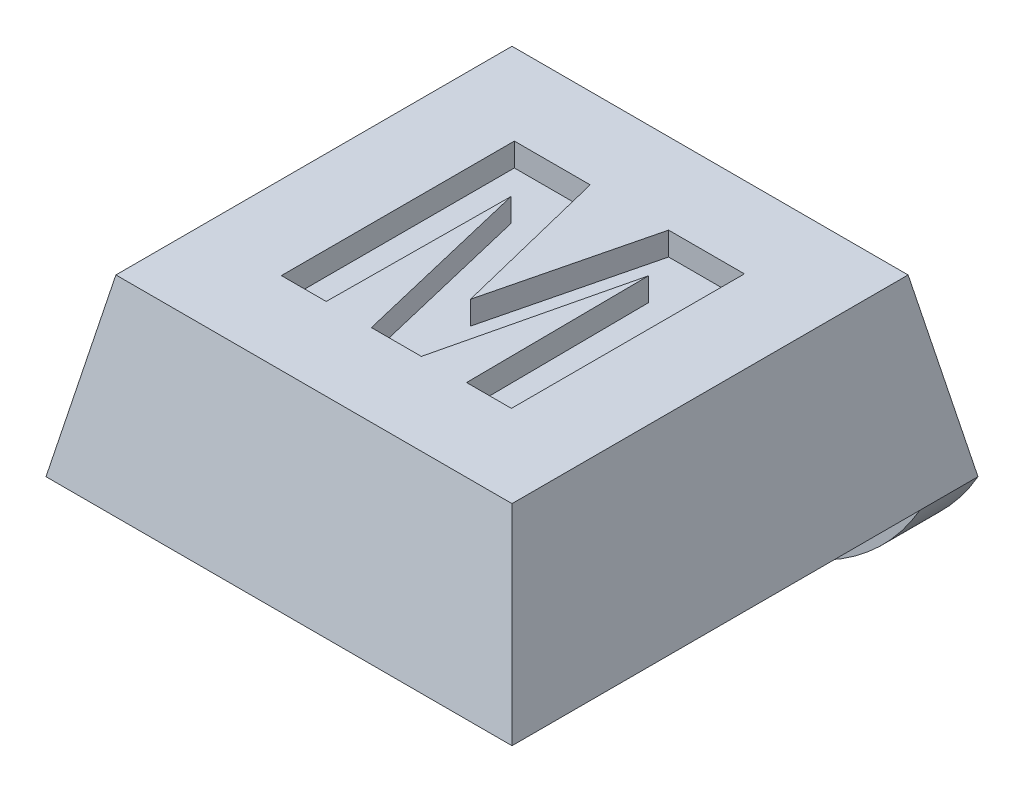
from build123d import *

# Parameters (mm, degrees)
SKETCH1_W               = 8
SKETCH1_H               = 8
BOSS_EXTRUDE1_DEPTH     = 3
CUT_EXTRUDE1_DEPTH      = 12.704699911
CUT_EXTRUDE1_DEPTH_BACK = 12.704699911
CUT_EXTRUDE2_DEPTH      = 11
SKETCH4_R               = 1.8
CUT_EXTRUDE3_DEPTH      = 0.8
SKETCH5_W               = 8
SKETCH5_H               = 1
BOSS_EXTRUDE2_DEPTH     = 2
FILLET1_R               = 4
CUT_EXTRUDE4_DEPTH      = 0.4


with BuildPart() as part:
    # Sketch1 → Boss-Extrude1 (new body)
    with BuildSketch(Plane(origin=(0, 0, 0), x_dir=(1, 0, 0), z_dir=(0, 1, 0))):
        with Locations((4, 4)):
            Rectangle(SKETCH1_W, SKETCH1_H)
    extrude(amount=BOSS_EXTRUDE1_DEPTH)

    # Sketch2 → Cut-Extrude1 (cut, two sides: drawn at the far end of the back side and taken through both)
    with BuildSketch(Plane.XY.offset(-CUT_EXTRUDE1_DEPTH_BACK)):
        Polygon((0, 0), (0.6, 3), (0, 3), align=None)
        Polygon((8, 0), (7.4, 3), (8, 3), align=None)
    extrude(amount=CUT_EXTRUDE1_DEPTH + CUT_EXTRUDE1_DEPTH_BACK, mode=Mode.SUBTRACT)

    # Sketch3 → Cut-Extrude2 (cut)
    with BuildSketch(Plane(origin=(0, 0, 0), x_dir=(0, 0, -1), z_dir=(1, 0, 0))):
        Polygon((0, 0), (0.6, 3), (0, 3), align=None)
        Polygon((8, 3), (7.4, 3), (8, 0), align=None)
    extrude(amount=CUT_EXTRUDE2_DEPTH, mode=Mode.SUBTRACT)

    # Sketch4 → Cut-Extrude3 (cut)
    with BuildSketch(Plane.XZ):
        with Locations(Location((4, -3.75, 0), (0, 0, 270))):
            Circle(SKETCH4_R)
    extrude(amount=-CUT_EXTRUDE3_DEPTH, mode=Mode.SUBTRACT)

    # Sketch5 → Boss-Extrude2 (add)
    with BuildSketch(Plane.XZ):
        with Locations((4, -7.5)):
            Rectangle(SKETCH5_W, SKETCH5_H)
    extrude(amount=BOSS_EXTRUDE2_DEPTH)

    # Fillet1
    # the kernel refuses this fillet: 4 mm, written as the material it takes off along each edge
    with BuildSketch(Plane(origin=(8, -2, -16.660254038), x_dir=(0, 1, 0), z_dir=(0, 0, 1)), Plane(origin=(0, -2, 1.660254038), x_dir=(0, 1, 0), z_dir=(0, 0, -1))) as fillet1_piece_1:
        with BuildLine():
            CenterArc((4, 3.464101615), FILLET1_R, 180, 60)
            Line((0, 3.464101615), (-0.08, 3.464101615))
            Line((-0.08, 3.464101615), (-0.08, 0))
            Line((-0.08, 0), (0, -0.08))
            ThreePointArc((0, -0.08), (1, -0.08), (1.96, -0.069282032))
            Line((1.96, -0.069282032), (2, 0))
        make_face()
    extrude(amount=18.320508076, mode=Mode.SUBTRACT)

    # Sketch6 → Cut-Extrude4 (cut)
    with BuildSketch(Plane(origin=(0, 3, 0), x_dir=(1, 0, 0), z_dir=(0, 1, 0))):
        Polygon((2.030290665, 2.010567225), (2.030290665, 6.010567225), (3.331572716, 6.010567225), (4.004649639, 3.28220184), (4.677726562, 6.010567225), (5.979008613, 6.010567225), (5.979008613, 2.010567225), (5.209777844, 2.010567225), (5.184136818, 5.159605686), (4.433335536, 2.010567225), (3.575963742, 2.010567225), (2.82516246, 5.159605686), (2.799521434, 2.010567225), align=None)
    extrude(amount=-CUT_EXTRUDE4_DEPTH, mode=Mode.SUBTRACT)


solid = part.part
